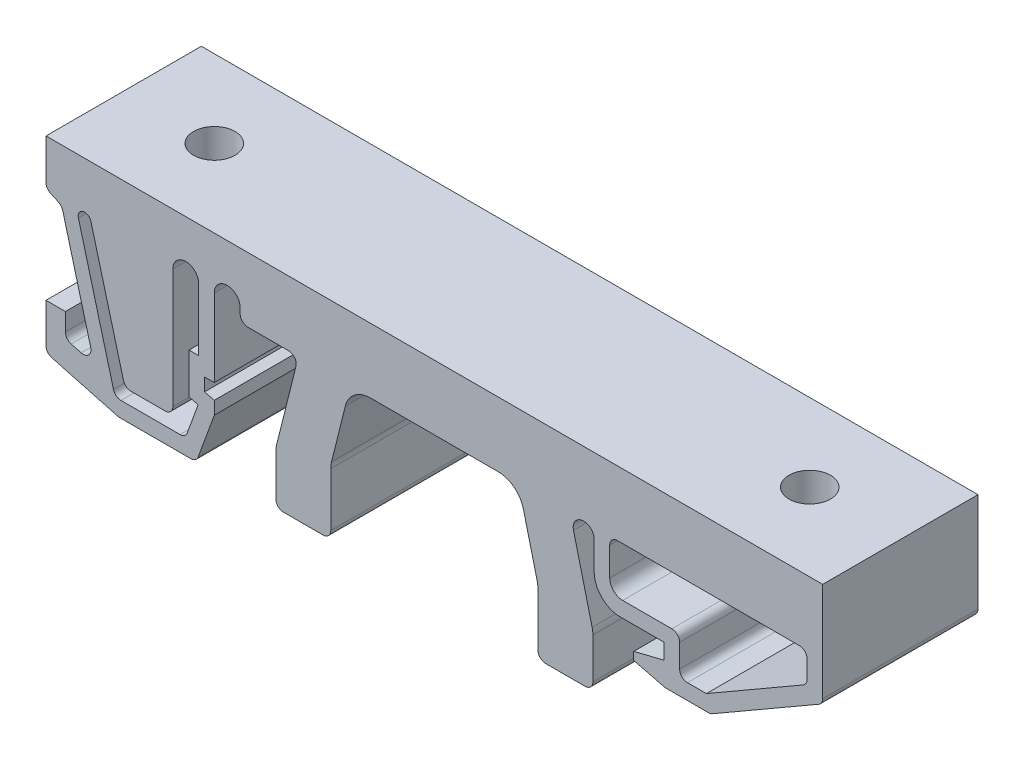
from build123d import *

# Parameters (mm, degrees)
BOSS_EXTRUDE1_DEPTH     = 6
CUT_EXTRUDE1_DEPTH      = 35.525353003
CUT_EXTRUDE1_DEPTH_BACK = 35.525353003
FILLET1_R               = 2
FILLET2_R               = 1
FILLET3_R               = 0.811424
FILLET4_R               = 2
FILLET5_R               = 1
FILLET6_R               = 1
FILLET7_R               = 0.5
FILLET8_R               = 0.6
SKETCH4_R               = 1.6
CUT_EXTRUDE2_DEPTH      = 8.5


with BuildPart() as part:
    # Sketch2 → Boss-Extrude1 (new, symmetric)
    with BuildSketch(Plane.XY):
        Polygon((6.5, 11), (-6.5, 11), (-8, 4.9838286), (-8, 0), (-12.25, 0), (-12.25, 3.981133366), (-10.5, 11), (-15, 11), (-15, 13), (-17, 13), (-17, 6), (-17.75, 6), (-17.75, 5), (-17, 4.813003998), (-17, 3.813003998), (-18.387819958, 0), (-24.387819958, 0), (-30, 1.50377911), (-30, 5.00377911), (-28.5, 5.00377911), (-28.5, 3.172407682), (-26.2783706, 2.577123878), (-28.785442178, 11.933642386), (-30, 12.5), (-30, 16), (0, 16), (30, 16), (30, 8), (21.339745962, 3), (17.839745962, 3), (15.4, 3.608296988), (15.4, 4.214079193), (17.75, 4.8), (17.75, 6), (12.35, 6), (12.35, 11), (10.5, 11), (12.25, 3.981133366), (12.25, 0), (8, 0), (8, 4.9838286), align=None)
    extrude(amount=BOSS_EXTRUDE1_DEPTH, both=True)

    # Sketch3 → Cut-Extrude1 (cut, two sides: drawn at the far end of the back side and taken through both)
    with BuildSketch(Plane.XY.offset(-CUT_EXTRUDE1_DEPTH_BACK)):
        Polygon((-27.626331186, 12.24422524), (-24.667039952, 1.2), (-19.228069004, 1.2), (-18.249764702, 3.88786898), (-18.95, 4.062457248), (-18.95, 7.2), (-18.2, 7.2), (-18.2, 13), (-20.2, 13), (-20.2, 2.2), (-23.899712964, 2.2), (-26.66040536, 12.503044285), align=None)
        Polygon((13.55, 11), (13.55, 7.2), (18.95, 7.2), (18.95, 4.2), (21.018206931, 4.2), (28.8, 8.692820323), (28.8, 11), align=None)
    extrude(amount=CUT_EXTRUDE1_DEPTH + CUT_EXTRUDE1_DEPTH_BACK, mode=Mode.SUBTRACT)

    # Fillet1
    fillet1_edges = [part.edges().sort_by_distance(p)[0] for p in [
        (12.35, 6, 0),
    ]]
    fillet(fillet1_edges, radius=FILLET1_R)

    # Fillet2
    fillet2_edges = [part.edges().sort_by_distance(p)[0] for p in [
        (13.55, 7.2, 0),
    ]]
    fillet(fillet2_edges, radius=FILLET2_R)

    # Fillet3
    fillet3_edges = [part.edges().sort_by_distance(p)[0] for p in [
        (12.35, 11, 0),
        (10.5, 11, 0),
    ]]
    fillet(fillet3_edges, radius=FILLET3_R)

    # Fillet4
    fillet4_edges = [part.edges().sort_by_distance(p)[0] for p in [
        (12.25, 3.981133366, 0),
        (8, 4.9838286, 0),
        (6.5, 11, 0),
        (-6.5, 11, 0),
        (-8, 4.9838286, 0),
        (-12.25, 3.981133366, 0),
    ]]
    fillet(fillet4_edges, radius=FILLET4_R)

    # Fillet5
    fillet5_edges = [part.edges().sort_by_distance(p)[0] for p in [
        (-20.2, 13, 0),
        (-18.2, 13, 0),
    ]]
    fillet(fillet5_edges, radius=FILLET5_R - 0.0001)  # a hair under: the kernel refuses the full size

    # Fillet6
    fillet6_edges = [part.edges().sort_by_distance(p)[0] for p in [
        (-15, 13, 0),
        (-17, 13, 0),
    ]]
    fillet(fillet6_edges, radius=FILLET6_R - 0.0001)  # a hair under: the kernel refuses the full size

    # Fillet7
    fillet7_edges = [part.edges().sort_by_distance(p)[0] for p in [
        (-27.626331186, 12.24422524, 0),
        (-26.66040536, 12.503044285, 0),
    ]]
    fillet(fillet7_edges, radius=FILLET7_R - 0.0001)  # a hair under: the kernel refuses the full size

    # Fillet8
    fillet8_edges = [part.edges().sort_by_distance(p)[0] for p in [
        (-23.899712964, 2.2, 0),
        (-20.2, 2.2, 0),
        (-19.228069004, 1.2, 0),
        (-24.667039952, 1.2, 0),
        (13.55, 11, 0),
        (28.8, 11, 0),
        (28.8, 8.692820323, 0),
        (18.95, 4.2, 0),
        (18.95, 7.2, 0),
        (12.25, 0, 0),
        (8, 0, 0),
        (-8, 0, 0),
        (-12.25, 0, 0),
        (-10.5, 11, 0),
        (-15, 11, 0),
        (-18.387819958, 0, 0),
        (-24.387819958, 0, 0),
        (-30, 1.50377911, 0),
        (-28.5, 3.172407682, 0),
        (-26.2783706, 2.577123878, 0),
        (-28.785442178, 11.933642386, 0),
        (-30, 12.5, 0),
        (30, 8, 0),
        (21.339745962, 3, 0),
        (17.839745962, 3, 0),
    ]]
    fillet(fillet8_edges, radius=FILLET8_R)

    # Sketch4 → Cut-Extrude2 (cut)
    with BuildSketch(Plane(origin=(0, 16, 0), x_dir=(1, 0, 0), z_dir=(0, 1, 0))):
        with Locations(Location((-23, 0, 0), (0, 0, 270))):
            Circle(SKETCH4_R)
        with Locations(Location((23, 0, 0), (0, 0, 180))):
            Circle(SKETCH4_R)
    extrude(amount=-CUT_EXTRUDE2_DEPTH, mode=Mode.SUBTRACT)


solid = part.part
